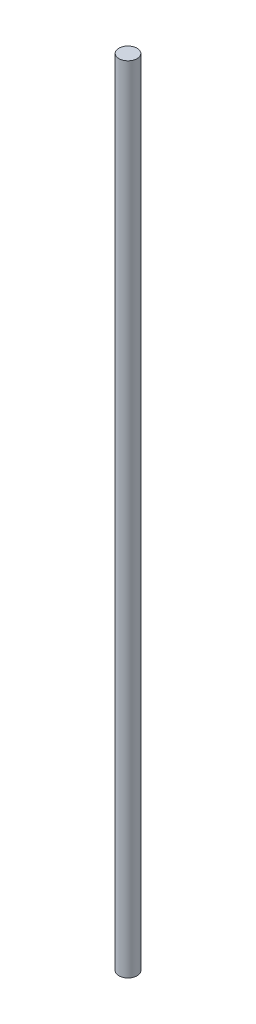
from build123d import *

# Parameters (mm, degrees)
BOSS_EXTRUDE1_DEPTH      = 175
BOSS_EXTRUDE1_DEPTH_BACK = 175
SKETCH1_R                = 4


with BuildPart() as part:
    # Sketch1 → Boss-Extrude1 (new, two sides: drawn at the far end of the back side and taken through both)
    with BuildSketch(Plane(origin=(0, 0, 0), x_dir=(1, 0, 0), z_dir=(0, 1, 0)).offset(-BOSS_EXTRUDE1_DEPTH_BACK)):
        Circle(SKETCH1_R)
    extrude(amount=BOSS_EXTRUDE1_DEPTH + BOSS_EXTRUDE1_DEPTH_BACK)


solid = part.part
